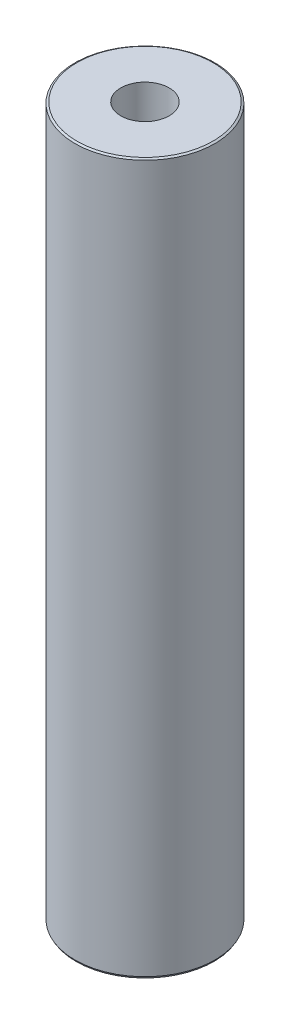
from build123d import *
from OCP.BRepFilletAPI import BRepFilletAPI_MakeChamfer

# Parameters (mm, degrees)
SKETCH1_R           = 52.5
BOSS_EXTRUDE1_DEPTH = 532.552060913
SKETCH2_R           = 18.171817276
CUT_EXTRUDE1_DEPTH  = 538.702703715
CHAMFER1_SIZE       = 0.838205987
CHAMFER1_SIZE2      = 1.451815357


with BuildPart() as part:
    # Sketch1 → Boss-Extrude1 (new body)
    with BuildSketch(Plane(origin=(0, 0, 0), x_dir=(1, 0, 0), z_dir=(0, 1, 0))):
        Circle(SKETCH1_R)
    extrude(amount=BOSS_EXTRUDE1_DEPTH)

    # Sketch2 → Cut-Extrude1 (cut, through all)
    with BuildSketch(Plane(origin=(0, 0, 0), x_dir=(1, 0, 0), z_dir=(0, 1, 0))):
        Circle(SKETCH2_R)
    extrude(amount=CUT_EXTRUDE1_DEPTH, mode=Mode.SUBTRACT)

    # Chamfer1: one chamfer whose edges measure the first distance from different faces: ONE call of the kernel's chamfer builder (chamfer() names one face for all edges)
    chamfer1_edges_1 = [part.edges().sort_by_distance(p)[0] for p in [
        (-52.5, 532.552060913, 0),
    ]]
    chamfer1_side_1 = [part.faces().sort_by_distance(p)[0] for p in [
        (-52.5, 266.276030456, 0),
    ]]
    chamfer1_edges_2 = [part.edges().sort_by_distance(p)[0] for p in [
        (-52.5, 0, 0),
    ]]
    chamfer1_side_2 = [part.faces().sort_by_distance(p)[0] for p in [
        (-51.01507576, 0, 0),
    ]]
    chamfer1 = BRepFilletAPI_MakeChamfer(part.part.solid().wrapped)
    for e in chamfer1_edges_1:
        chamfer1.Add(CHAMFER1_SIZE, CHAMFER1_SIZE2, e.wrapped, chamfer1_side_1[0].wrapped)  # the first distance lies on this face
    for e in chamfer1_edges_2:
        chamfer1.Add(CHAMFER1_SIZE, CHAMFER1_SIZE2, e.wrapped, chamfer1_side_2[0].wrapped)  # the first distance lies on this face
    add(Compound.cast(chamfer1.Shape()), mode=Mode.REPLACE)


solid = part.part
